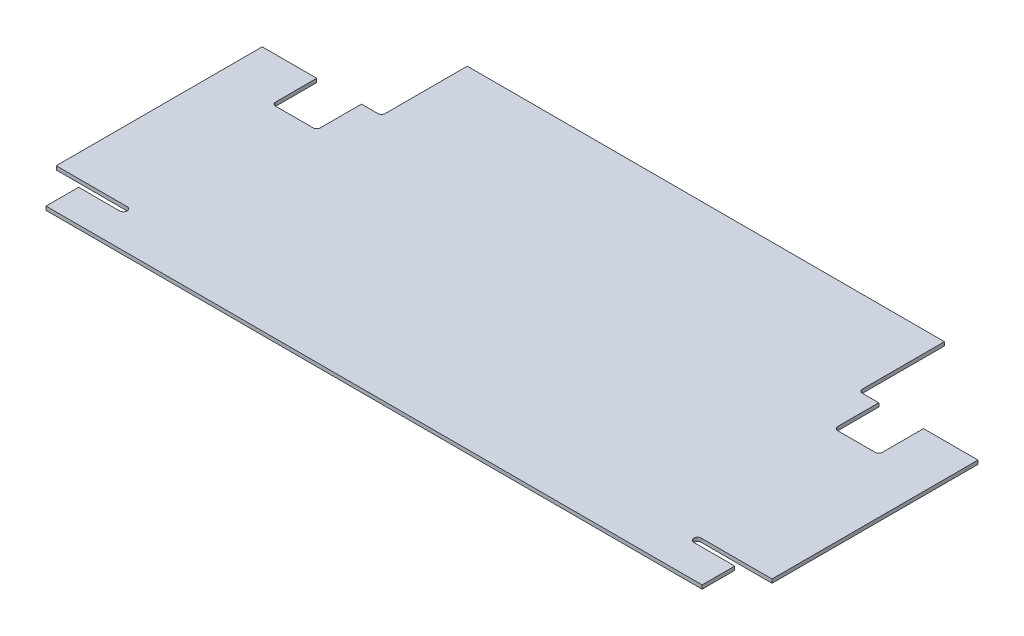
from build123d import *

# Parameters (mm, degrees)
SKETCH1_W            = 609.6
SKETCH1_H            = 304.8
BOSS_EXTRUDE1_DEPTH  = 3.175
CUT_EXTRUDE1_REACH   = 342.792
FILLET1_R            = 3.175
CUT_EXTRUDE2_REACH   = 342.792
SKETCH4_W            = 38.1
SKETCH4_H            = 38.1
FILLET2_R            = 3.175
FILLET2_OF_MIRROR1_R = 3.175
CUT_EXTRUDE3_REACH   = 342.792
FILLET3_R            = 3.175
FILLET3_OF_MIRROR2_R = 3.175


with BuildPart() as part:
    # Sketch1 → Boss-Extrude1 (new body)
    with BuildSketch(Plane(origin=(0, 0, 0), x_dir=(1, 0, 0), z_dir=(0, 1, 0))):
        Rectangle(SKETCH1_W, SKETCH1_H)
    extrude(amount=BOSS_EXTRUDE1_DEPTH)

    # Sketch3 → Cut-Extrude1 (cut, up to next)
    with BuildSketch(Plane(origin=(0, 3.175, 0), x_dir=(1, 0, 0), z_dir=(0, 1, 0)), mode=Mode.PRIVATE) as cut_extrude1_sk1:
        Polygon((-304.8, 152.4), (304.8, 152.4), (304.8, 57.15), (203.2, 57.15), (203.2, 130.175), (-203.2, 130.175), (-203.2, 57.15), (-304.8, 57.15), align=None)
    cut_extrude1_tool1 = extrude(cut_extrude1_sk1.sketch, amount=-CUT_EXTRUDE1_REACH, mode=Mode.PRIVATE) & part.part
    add(cut_extrude1_tool1.solids().sort_by_distance((0, 3.175, -146.230035))[0], mode=Mode.SUBTRACT)

    # Fillet1
    fillet1_edges = [part.edges().sort_by_distance(p)[0] for p in [
        (203.2, 1.5875, -57.15),
        (-203.2, 1.5875, -57.15),
    ]]
    fillet(fillet1_edges, radius=FILLET1_R)

    # Sketch4 → Cut-Extrude2 (cut, up to next)
    with BuildSketch(Plane(origin=(0, 3.175, 0), x_dir=(1, 0, 0), z_dir=(0, 1, 0)), mode=Mode.PRIVATE) as cut_extrude2_sk1:
        with Locations((239.3315, 38.1)):
            Rectangle(SKETCH4_W, SKETCH4_H)
    cut_extrude2_tool1 = extrude(cut_extrude2_sk1.sketch, amount=-CUT_EXTRUDE2_REACH, mode=Mode.PRIVATE) & part.part
    cut_extrude2 = cut_extrude2_tool1.solids().sort_by_distance((239.3315, 3.175, -38.1))[0]
    add(cut_extrude2, mode=Mode.SUBTRACT)

    # Fillet2
    fillet2_edges = [part.edges().sort_by_distance(p)[0] for p in [
        (258.3815, 1.5875, -19.05),
        (220.2815, 1.5875, -19.05),
    ]]
    fillet(fillet2_edges, radius=FILLET2_R)

    # Mirror1: Cut-Extrude2 across plane
    add(cut_extrude2.mirror(Plane(origin=(0, 0, 0), x_dir=(0, 0, 1), z_dir=(1, 0, 0))), mode=Mode.SUBTRACT)

    # Fillet2 of Mirror1
    fillet2_of_mirror1_edges = [part.edges().sort_by_distance(p)[0] for p in [
        (-258.3815, 1.5875, -19.05),
        (-220.2815, 1.5875, -19.05),
    ]]
    fillet(fillet2_of_mirror1_edges, radius=FILLET2_OF_MIRROR1_R)

    # Sketch5 → Cut-Extrude3 (cut, up to next)
    with BuildSketch(Plane(origin=(0, 3.175, 0), x_dir=(1, 0, 0), z_dir=(0, 1, 0)), mode=Mode.PRIVATE) as cut_extrude3_sk1:
        Polygon((-279.4, -152.4), (-279.4, -124.61875), (-241.3, -124.61875), (-241.3, -118.26875), (-304.8, -118.26875), (-304.8, -152.4), align=None)
    cut_extrude3_tool1 = extrude(cut_extrude3_sk1.sketch, amount=-CUT_EXTRUDE3_REACH, mode=Mode.PRIVATE) & part.part
    cut_extrude3 = cut_extrude3_tool1.solids().sort_by_distance((-285.172727, 3.175, 132.303693))[0]
    add(cut_extrude3, mode=Mode.SUBTRACT)

    # Fillet3
    fillet3_edges = [part.edges().sort_by_distance(p)[0] for p in [
        (-241.3, 1.5875, 124.61875),
        (-241.3, 1.5875, 118.26875),
    ]]
    fillet(fillet3_edges, radius=FILLET3_R - 0.0001)  # a hair under: the kernel refuses the full size

    # Mirror2: Cut-Extrude3 across plane
    add(cut_extrude3.mirror(Plane(origin=(0, 0, 0), x_dir=(0, 0, 1), z_dir=(1, 0, 0))), mode=Mode.SUBTRACT)

    # Fillet3 of Mirror2
    fillet3_of_mirror2_edges = [part.edges().sort_by_distance(p)[0] for p in [
        (241.3, 1.5875, 124.61875),
        (241.3, 1.5875, 118.26875),
    ]]
    fillet(fillet3_of_mirror2_edges, radius=FILLET3_OF_MIRROR2_R - 0.0001)  # a hair under: the kernel refuses the full size


solid = part.part
